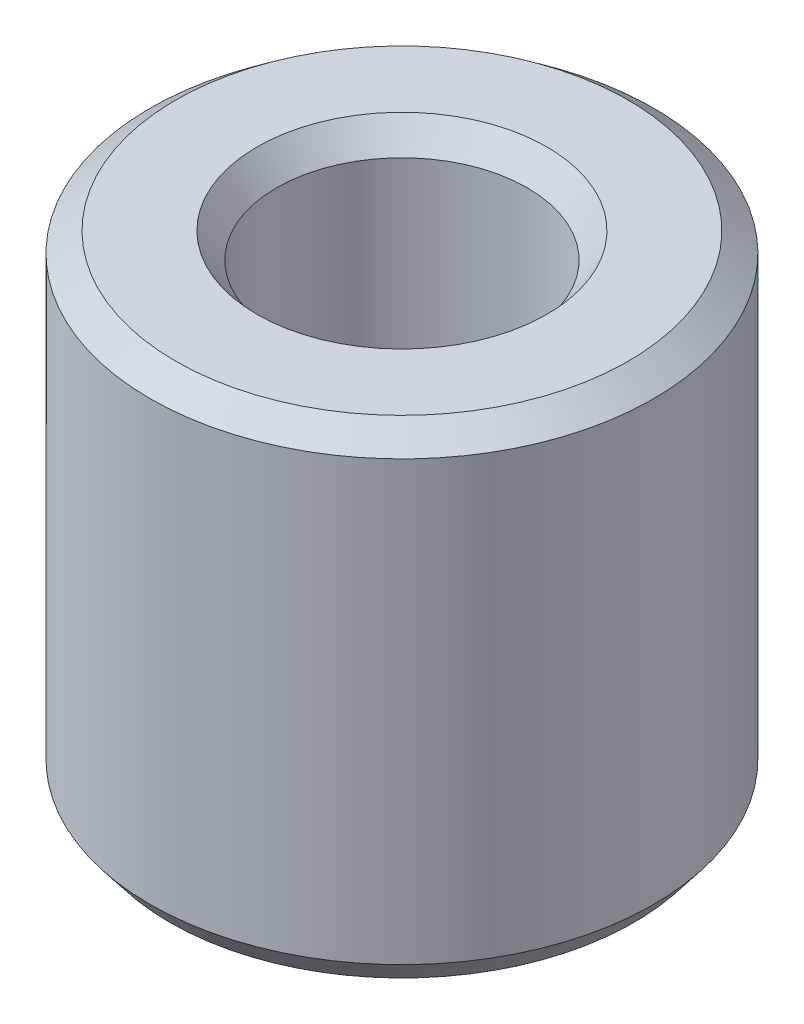
from build123d import *
from OCP.BRepFilletAPI import BRepFilletAPI_MakeChamfer

# Parameters (mm, degrees)
SKETCH1_R           = 35
BOSS_EXTRUDE1_DEPTH = 67.184748937
SKETCH2_R           = 17.421533663
CUT_EXTRUDE1_DEPTH  = 84.449328875
CHAMFER1_SIZE       = 2.739825248
CHAMFER1_SIZE2      = 3.543338353


with BuildPart() as part:
    # Sketch1 → Boss-Extrude1 (new body)
    with BuildSketch(Plane(origin=(0, 0, 0), x_dir=(1, 0, 0), z_dir=(0, 1, 0))):
        Circle(SKETCH1_R)
    extrude(amount=BOSS_EXTRUDE1_DEPTH)

    # Sketch2 → Cut-Extrude1 (cut, through all)
    with BuildSketch(Plane(origin=(0, 0, 0), x_dir=(1, 0, 0), z_dir=(0, 1, 0))):
        Circle(SKETCH2_R)
    extrude(amount=CUT_EXTRUDE1_DEPTH, mode=Mode.SUBTRACT)

    # Chamfer1: one chamfer whose edges measure the first distance from different faces: ONE call of the kernel's chamfer builder (chamfer() names one face for all edges)
    chamfer1_edges_1 = [part.edges().sort_by_distance(p)[0] for p in [
        (-17.421533663, 67.184748937, 0),
    ]]
    chamfer1_side_1 = [part.faces().sort_by_distance(p)[0] for p in [
        (-34.010050506, 67.184748937, 0),
    ]]
    chamfer1_edges_2 = [part.edges().sort_by_distance(p)[0] for p in [
        (-17.421533663, 0, 0),
    ]]
    chamfer1_side_2 = [part.faces().sort_by_distance(p)[0] for p in [
        (-17.421533663, 33.592374468, 0),
    ]]
    chamfer1_edges_3 = [part.edges().sort_by_distance(p)[0] for p in [
        (-35, 0, 0),
    ]]
    chamfer1_side_3 = [part.faces().sort_by_distance(p)[0] for p in [
        (-34.010050506, 0, 0),
    ]]
    chamfer1_edges_4 = [part.edges().sort_by_distance(p)[0] for p in [
        (-35, 67.184748937, 0),
    ]]
    chamfer1_side_4 = [part.faces().sort_by_distance(p)[0] for p in [
        (-35, 33.592374468, 0),
    ]]
    chamfer1 = BRepFilletAPI_MakeChamfer(part.part.solid().wrapped)
    for e in chamfer1_edges_1:
        chamfer1.Add(CHAMFER1_SIZE, CHAMFER1_SIZE2, e.wrapped, chamfer1_side_1[0].wrapped)  # the first distance lies on this face
    for e in chamfer1_edges_2:
        chamfer1.Add(CHAMFER1_SIZE, CHAMFER1_SIZE2, e.wrapped, chamfer1_side_2[0].wrapped)  # the first distance lies on this face
    for e in chamfer1_edges_3:
        chamfer1.Add(CHAMFER1_SIZE, CHAMFER1_SIZE2, e.wrapped, chamfer1_side_3[0].wrapped)  # the first distance lies on this face
    for e in chamfer1_edges_4:
        chamfer1.Add(CHAMFER1_SIZE, CHAMFER1_SIZE2, e.wrapped, chamfer1_side_4[0].wrapped)  # the first distance lies on this face
    add(Compound.cast(chamfer1.Shape()), mode=Mode.REPLACE)


solid = part.part
